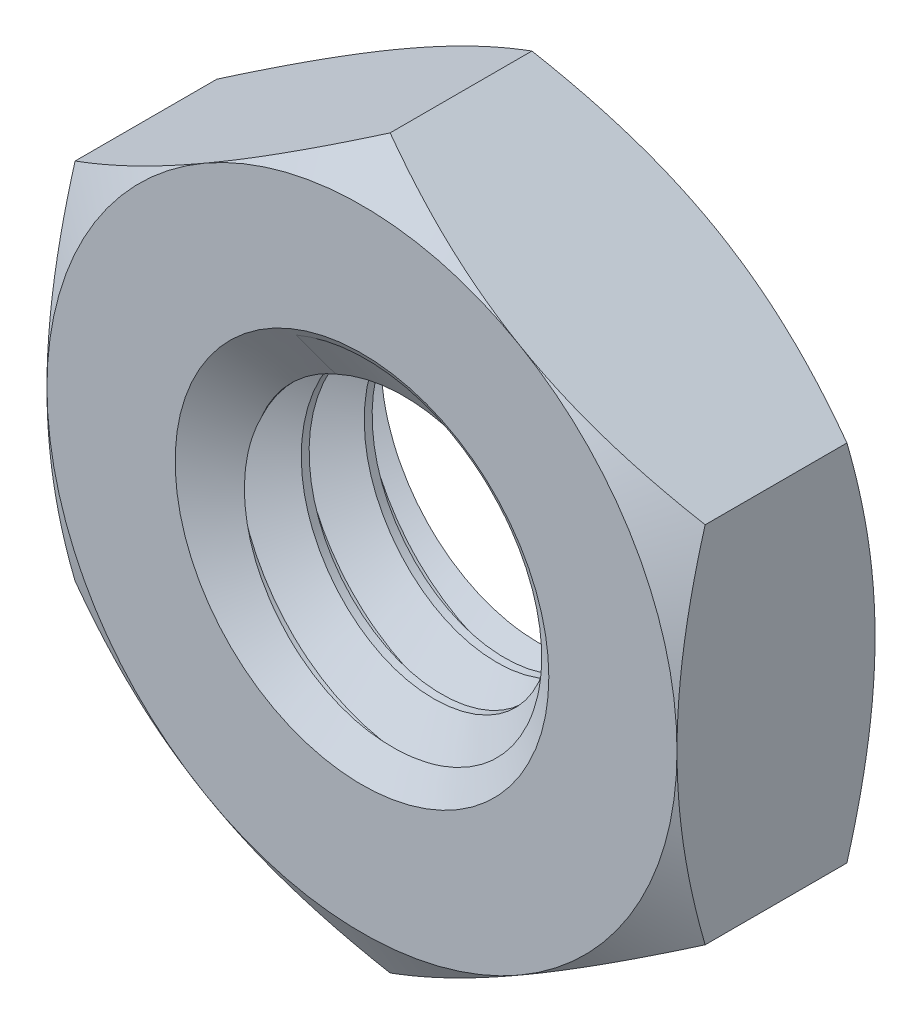
from build123d import *

# Parameters (mm, degrees)
SKETCH3_R                    = 2
BOSS_EXTRUDE1_DEPTH          = 1.1
SKETCH4_OUTSIDE_W            = 45.824
SKETCH4_OUTSIDE_H            = 46.906
SKETCH4_OUTSIDE_R            = 3.5
CUT_EXTRUDE1_DEPTH           = 10
CUT_EXTRUDE1_DRAFT           = -60
SKETCH4_OUTSIDE_R_2          = 2.075777223
CUT_EXTRUDE1_PROFILE_2_DEPTH = 10
CUT_EXTRUDE1_PROFILE_2_DRAFT = -60
MIRROR1_COPY_1_SKETCH_W      = 45.824
MIRROR1_COPY_1_SKETCH_H      = 46.906
MIRROR1_COPY_1_SKETCH_R      = 3.5
MIRROR1_COPY_1_DEPTH         = 10
MIRROR1_COPY_1_DRAFT         = -60
MIRROR1_COPY_2_SKETCH_R      = 2.075777223
MIRROR1_COPY_2_DEPTH         = 10
MIRROR1_COPY_2_DRAFT         = -60
MIRROR1_COPY_3_SKETCH_R      = 2.075777223
MIRROR1_COPY_3_DEPTH         = 10
MIRROR1_COPY_3_DRAFT         = -60
SWEEP1_PITCH                 = 0.7
SKETCH8_R                    = 2.075777223
CUT_EXTRUDE2_OTHER_WAY_DEPTH = 7.0926749


# Read off the part's stored shape, not the designer's step: Mirror2
with BuildPart() as part:
    # Sketch3 → Boss-Extrude1 (new, symmetric)
    with BuildSketch(Plane.XY):
        Polygon((-3.5, 2.020725942), (-3.5, -2.020725942), (0, -4.041451884), (3.5, -2.020725942), (3.5, 2.020725942), (0, 4.041451884), align=None)
        Circle(SKETCH3_R, mode=Mode.SUBTRACT)
    extrude(amount=BOSS_EXTRUDE1_DEPTH, both=True)


with BuildPart() as cut_extrude1_tool:
    # Sketch4 outside → Cut-Extrude1 (with draft: the straight prism first)
    with BuildSketch(Plane.XY.offset(1.1)):
        Rectangle(SKETCH4_OUTSIDE_W, SKETCH4_OUTSIDE_H)
        Circle(SKETCH4_OUTSIDE_R, mode=Mode.SUBTRACT)
    extrude(amount=-CUT_EXTRUDE1_DEPTH)
    # Cut-Extrude1: the draft: its side faces are tilted about the plane it starts from
    cut_extrude1_sides = [cut_extrude1_tool.faces().sort_by_distance(p)[0] for p in [
        (0, -23.453, -3.9),
        (22.912, 0, -3.9),
        (0, 23.453, -3.9),
        (-22.912, 0, -3.9),
        (-3.5, 0, -3.9),
    ]]
    draft(cut_extrude1_sides, Plane.XY.offset(1.1), CUT_EXTRUDE1_DRAFT)


with BuildPart() as part_1:
    add(part.part)

    # Cut-Extrude1: cut by cut_extrude1_tool
    add(cut_extrude1_tool.part, mode=Mode.SUBTRACT)


with BuildPart() as cut_extrude1_profile_2_tool:
    # Sketch4 outside → Cut-Extrude1 profile 2 (with draft: the straight prism first)
    with BuildSketch(Plane.XY.offset(1.1)):
        Circle(SKETCH4_OUTSIDE_R_2)
    extrude(amount=-CUT_EXTRUDE1_PROFILE_2_DEPTH)
    # Cut-Extrude1 profile 2: the draft: its side faces are tilted about the plane it starts from
    cut_extrude1_profile_2_sides = [cut_extrude1_profile_2_tool.faces().sort_by_distance(p)[0] for p in [
        (-2.075777223, 0, -3.9),
    ]]
    draft(cut_extrude1_profile_2_sides, Plane.XY.offset(1.1), CUT_EXTRUDE1_PROFILE_2_DRAFT)


with BuildPart() as part_2:
    add(part_1.part)

    # Cut-Extrude1 profile 2: cut by cut_extrude1_profile_2_tool
    add(cut_extrude1_profile_2_tool.part, mode=Mode.SUBTRACT)


with BuildPart() as mirror1_copy_1_tool:
    # Mirror1 copy 1 sketch → Mirror1 copy 1 (with draft: the straight prism first)
    with BuildSketch(Plane(origin=(0, 0, -1.1), x_dir=(1, 0, 0), z_dir=(0, 0, -1))):
        Rectangle(MIRROR1_COPY_1_SKETCH_W, MIRROR1_COPY_1_SKETCH_H)
        Circle(MIRROR1_COPY_1_SKETCH_R, mode=Mode.SUBTRACT)
    extrude(amount=-MIRROR1_COPY_1_DEPTH)
    # Mirror1 copy 1: the draft: its side faces are tilted about the plane it starts from
    mirror1_copy_1_sides = [mirror1_copy_1_tool.faces().sort_by_distance(p)[0] for p in [
        (0, -23.453, 3.9),
        (22.912, 0, 3.9),
        (0, 23.453, 3.9),
        (-22.912, 0, 3.9),
        (-3.5, 0, 3.9),
    ]]
    draft(mirror1_copy_1_sides, Plane(origin=(0, 0, -1.1), x_dir=(1, 0, 0), z_dir=(0, 0, -1)), MIRROR1_COPY_1_DRAFT)


with BuildPart() as part_3:
    add(part_2.part)

    # Mirror1 copy 1: cut by mirror1_copy_1_tool
    add(mirror1_copy_1_tool.part, mode=Mode.SUBTRACT)


with BuildPart() as mirror1_copy_2_tool:
    # Mirror1 copy 2 sketch → Mirror1 copy 2 (with draft: the straight prism first)
    with BuildSketch(Plane(origin=(0, 0, -1.1), x_dir=(1, 0, 0), z_dir=(0, 0, -1))):
        Circle(MIRROR1_COPY_2_SKETCH_R)
    extrude(amount=-MIRROR1_COPY_2_DEPTH)
    # Mirror1 copy 2: the draft: its side faces are tilted about the plane it starts from
    mirror1_copy_2_sides = [mirror1_copy_2_tool.faces().sort_by_distance(p)[0] for p in [
        (-2.075777223, 0, 3.9),
    ]]
    draft(mirror1_copy_2_sides, Plane(origin=(0, 0, -1.1), x_dir=(1, 0, 0), z_dir=(0, 0, -1)), MIRROR1_COPY_2_DRAFT)


with BuildPart() as part_4:
    add(part_3.part)

    # Mirror1 copy 2: cut by mirror1_copy_2_tool
    add(mirror1_copy_2_tool.part, mode=Mode.SUBTRACT)


with BuildPart() as mirror1_copy_3_tool:
    # Mirror1 copy 3 sketch → Mirror1 copy 3 (with draft: the straight prism first)
    with BuildSketch(Plane(origin=(0, 0, -1.1), x_dir=(1, 0, 0), z_dir=(0, 0, -1))):
        Circle(MIRROR1_COPY_3_SKETCH_R)
    extrude(amount=-MIRROR1_COPY_3_DEPTH)
    # Mirror1 copy 3: the draft: its side faces are tilted about the plane it starts from
    mirror1_copy_3_sides = [mirror1_copy_3_tool.faces().sort_by_distance(p)[0] for p in [
        (-2.075777223, 0, 3.9),
    ]]
    draft(mirror1_copy_3_sides, Plane(origin=(0, 0, -1.1), x_dir=(1, 0, 0), z_dir=(0, 0, -1)), MIRROR1_COPY_3_DRAFT)


with BuildPart() as part_5:
    add(part_4.part)

    # Mirror1 copy 3: cut by mirror1_copy_3_tool
    add(mirror1_copy_3_tool.part, mode=Mode.SUBTRACT)

    # Sweep1: the profile of Sketch7 screwed along a right-hand helix of 4.142857 turns, 6 arcs to a turn; built about Z, then put on its axis
    sweep1_z = Axis((0, 0, 0), (0, 0, 1))
    sweep1_corners = [(2.037888611, 0, -0.634375), (2.037888611, 0, 0.021875), (1.545336663, 0, -0.2625), (1.545336663, 0, -0.35)]
    with BuildLine(mode=Mode.PRIVATE) as sweep1_profile:
        Line(sweep1_corners[0], sweep1_corners[1])
        Line(sweep1_corners[1], sweep1_corners[2])
        Line(sweep1_corners[2], sweep1_corners[3])
        Line(sweep1_corners[3], sweep1_corners[0])
    sweep1_cap = Face(sweep1_profile.wire())
    sweep1_turn_angles = [0, 30, 60, 90, 120, 150, 180, 210, 240, 270, 300, 330, 360]
    sweep1_turn_weights = [1, 0.8660254037844387, 1, 0.8660254037844387, 1, 0.8660254037844387, 1, 0.8660254037844387, 1, 0.8660254037844387, 1, 0.8660254037844387, 1]
    sweep1_turn_rails = [Edge.make_bspline([Vector(p[0], p[1], 0).rotate(sweep1_z, sweep1_turn_angles[k]) / sweep1_turn_weights[k] + Vector(0, 0, p[2] + SWEEP1_PITCH * sweep1_turn_angles[k] / 360) for k in range(13)], [0, 0, 0, 1, 1, 2, 2, 3, 3, 4, 4, 5, 5, 6, 6, 6], 2, sweep1_turn_weights) for p in sweep1_corners]
    sweep1_turn_sides = [Face.make_surface_from_curves(sweep1_turn_rails[p[0]], sweep1_turn_rails[p[1]]) for p in [(0, 1), (1, 2), (2, 3), (3, 0)]]
    sweep1_last_angles = [1440, 1465.714285714, 1491.428571429]
    sweep1_last_weights = [1, 0.9009688679024023, 1]
    sweep1_last_rails = [Edge.make_bspline([Vector(p[0], p[1], 0).rotate(sweep1_z, sweep1_last_angles[k]) / sweep1_last_weights[k] + Vector(0, 0, p[2] + SWEEP1_PITCH * sweep1_last_angles[k] / 360) for k in range(3)], [0, 0, 0, 1, 1, 1], 2, sweep1_last_weights) for p in sweep1_corners]
    sweep1_last_sides = [Face.make_surface_from_curves(sweep1_last_rails[p[0]], sweep1_last_rails[p[1]]) for p in [(0, 1), (1, 2), (2, 3), (3, 0)]]
    sweep1 = Plane(origin=(0, 0, 1.1), x_dir=(0, 1, 0), z_dir=(0, 0, -1)) * Solid(Shell([*[p.moved(Location((0, 0, SWEEP1_PITCH * i))) for i in range(4) for p in sweep1_turn_sides], *sweep1_last_sides, sweep1_cap, sweep1_cap.rotate(sweep1_z, 1491.428571429).moved(Location((0, 0, SWEEP1_PITCH * 1491.428571429 / 360)))]))
    add(sweep1)

    # Cut-Extrude2 cone 1 section (through the dimple's axis) → Cut-Extrude2 (revolve, cut)
    with BuildSketch(Plane(origin=(0, 0, 1.1), x_dir=(0, -1, 0), z_dir=(1, 0, 0))):
        Polygon((0, 0), (2.075777223, 0), (0, 1.198450538), align=None)
    revolve(axis=Axis((0, 0, 1.1), (0, 0, -1)), mode=Mode.SUBTRACT)

    # Sketch8 → Cut-Extrude2 other way (cut)
    with BuildSketch(Plane.XY.offset(1.1)):
        Circle(SKETCH8_R)
    extrude(amount=CUT_EXTRUDE2_OTHER_WAY_DEPTH, mode=Mode.SUBTRACT)

    # Mirror2 outline → Mirror2 (revolve, cut)
    with BuildSketch(Plane.XZ):
        Polygon((2.075777223, -1.1), (1.545327333, -0.793744613), (1.545327333, -1.822829203), (2.075777223, -1.822829203), align=None)
    revolve(axis=Axis((0, 0, 0), (0, 0, 1)), mode=Mode.SUBTRACT)


solid = part_5.part
